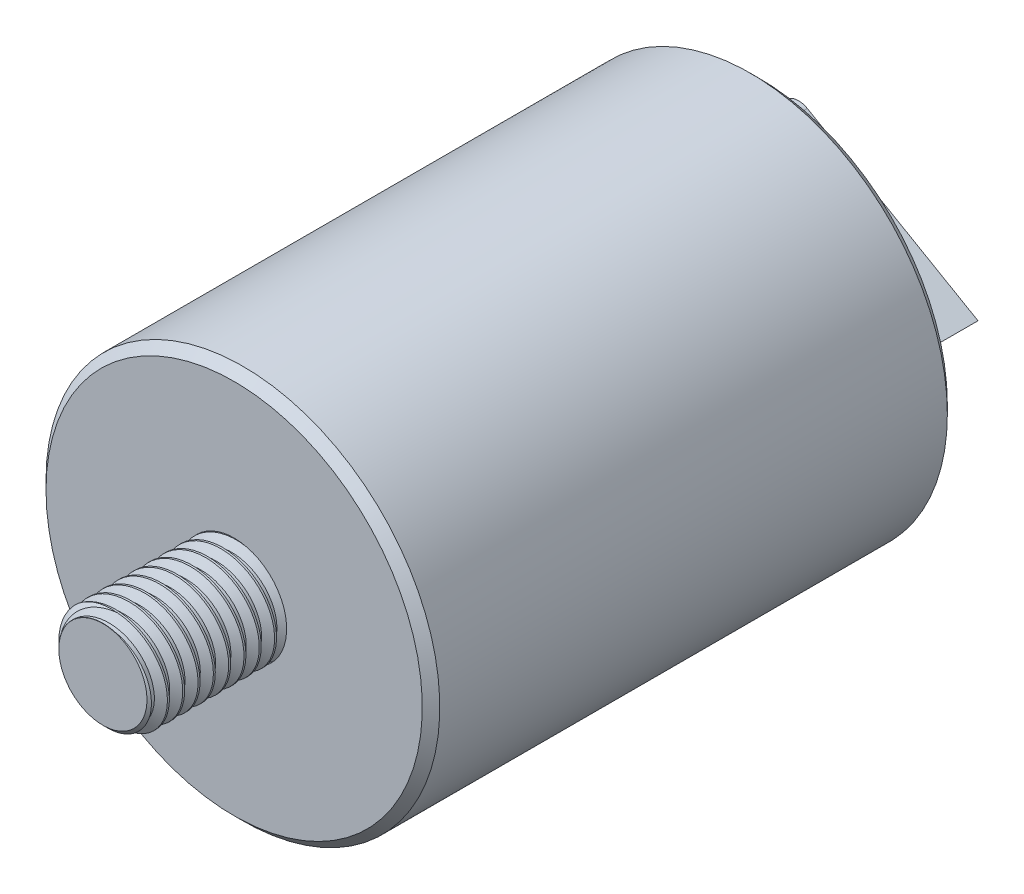
from build123d import *

# Parameters (mm, degrees)
SKETCH1_R           = 22.5
BOSS_EXTRUDE1_DEPTH = 75
THREAD1_PITCH       = 1.75
CHAMFER1_SIZE       = 1
BOSS_EXTRUDE2_DEPTH = 10


# Read off the part's stored shape, not the designer's step: M12x1.75 Machine Threads Stud2
with BuildPart() as part:
    # Sketch1 → Boss-Extrude1 (new body)
    with BuildSketch(Plane.XY):
        Circle(SKETCH1_R)
    extrude(amount=BOSS_EXTRUDE1_DEPTH)

    # M12x1.75 Machine Threads Stud2 outline → M12x1.75 Machine Threads Stud2 (revolve, cut)
    with BuildSketch(Plane.XZ):
        Polygon((22.5, 75), (5.036, 75), (6, 74.036), (6, 60), (22.5, 60), align=None)
    revolve(axis=Axis((0, 0, 0), (0, 0, 1)), mode=Mode.SUBTRACT)

    # Thread1: the profile of Thread Profile1 profile screwed along a right-hand helix of 10.285714 turns, 10 arcs to a turn; built about Z, then put on its axis
    thread1_z = Axis((0, 0, 0), (0, 0, 1))
    thread1_corners = [(6.0003, 0, -0.000173205), (6.0003, 0, 1.5314232), (5.052784719, 0, 0.984374998), (5.052784719, 0, 0.546874998)]
    with BuildLine(mode=Mode.PRIVATE) as thread1_profile:
        Line(thread1_corners[0], thread1_corners[1])
        Line(thread1_corners[1], thread1_corners[2])
        Line(thread1_corners[2], thread1_corners[3])
        Line(thread1_corners[3], thread1_corners[0])
    thread1_cap = Face(thread1_profile.wire())
    thread1_turn_angles = [0, 18, 36, 54, 72, 90, 108, 126, 144, 162, 180, 198, 216, 234, 252, 270, 288, 306, 324, 342, 360]
    thread1_turn_weights = [1, 0.9510565162951535, 1, 0.9510565162951535, 1, 0.9510565162951535, 1, 0.9510565162951535, 1, 0.9510565162951535, 1, 0.9510565162951535, 1, 0.9510565162951535, 1, 0.9510565162951535, 1, 0.9510565162951535, 1, 0.9510565162951535, 1]
    thread1_turn_rails = [Edge.make_bspline([Vector(p[0], p[1], 0).rotate(thread1_z, thread1_turn_angles[k]) / thread1_turn_weights[k] + Vector(0, 0, p[2] + THREAD1_PITCH * thread1_turn_angles[k] / 360) for k in range(21)], [0, 0, 0, 1, 1, 2, 2, 3, 3, 4, 4, 5, 5, 6, 6, 7, 7, 8, 8, 9, 9, 10, 10, 10], 2, thread1_turn_weights) for p in thread1_corners]
    thread1_turn_sides = [Face.make_surface_from_curves(thread1_turn_rails[p[0]], thread1_turn_rails[p[1]]) for p in [(0, 1), (1, 2), (2, 3), (3, 0)]]
    thread1_last_angles = [3600, 3618, 3636, 3654, 3672, 3687.428571429, 3702.857142857]
    thread1_last_weights = [1, 0.9510565162951535, 1, 0.9510565162951535, 1, 0.9639628606958538, 1]
    thread1_last_rails = [Edge.make_bspline([Vector(p[0], p[1], 0).rotate(thread1_z, thread1_last_angles[k]) / thread1_last_weights[k] + Vector(0, 0, p[2] + THREAD1_PITCH * thread1_last_angles[k] / 360) for k in range(7)], [0, 0, 0, 1, 1, 2, 2, 3, 3, 3], 2, thread1_last_weights) for p in thread1_corners]
    thread1_last_sides = [Face.make_surface_from_curves(thread1_last_rails[p[0]], thread1_last_rails[p[1]]) for p in [(0, 1), (1, 2), (2, 3), (3, 0)]]
    thread1 = Plane(origin=(0, 0, 76.036), x_dir=(-1, 0, 0), z_dir=(0, 0, -1)) * Solid(Shell([*[p.moved(Location((0, 0, THREAD1_PITCH * i))) for i in range(10) for p in thread1_turn_sides], *thread1_last_sides, thread1_cap, thread1_cap.rotate(thread1_z, 3702.857142857).moved(Location((0, 0, THREAD1_PITCH * 3702.857142857 / 360)))]))
    add(thread1, mode=Mode.SUBTRACT)

    # Chamfer1
    chamfer1_edges = [part.edges().sort_by_distance(p)[0] for p in [
        (-22.5, 0, 0),
        (-22.5, 0, 60),
    ]]
    chamfer(chamfer1_edges, length=CHAMFER1_SIZE)

    # Sketch10 → Boss-Extrude2 (add)
    with BuildSketch(Plane(origin=(0, 0, 0), x_dir=(-1, 0, 0), z_dir=(0, 0, -1))):
        with BuildLine():
            Line((-15.001928062, 0), (4.500964031, -11.26))
            ThreePointArc((4.500964031, -11.26), (6.500964031, -11.26), (7.500964031, -9.527949192))
            Line((7.500964031, -9.527949192), (7.500964031, 9.527949192))
            ThreePointArc((7.500964031, 9.527949192), (6.500964031, 11.26), (4.500964031, 11.26))
            Line((4.500964031, 11.26), (-15.001928062, 0))
        make_face()
    extrude(amount=BOSS_EXTRUDE2_DEPTH)


solid = part.part
